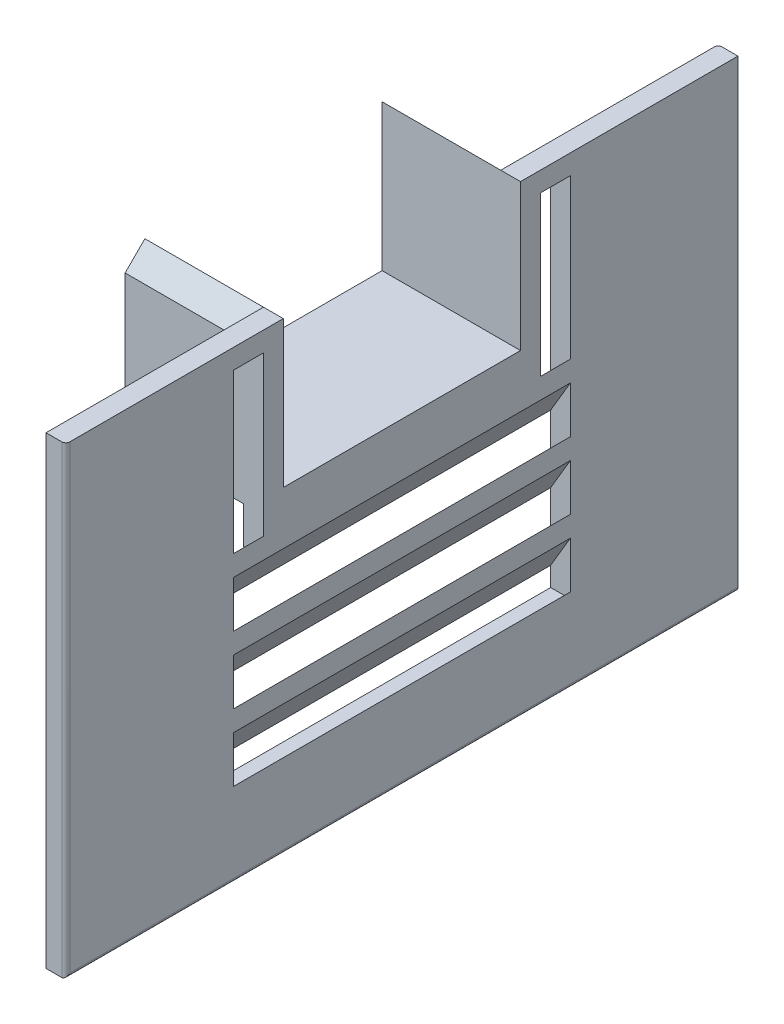
from build123d import *

# Parameters (mm, degrees)
BOSS_EXTRU_3_DEPTH             = 5
ESQUISSE6_W                    = 85.242430228
ESQUISSE6_H                    = 5.217313119
R_P_TITION_LIN_AIRE1_COUNT     = 3
R_P_TITION_LIN_AIRE1_PITCH     = 17
R_P_TITION_LIN_AIRE1_COL_COUNT = 2
R_P_TITION_LIN_AIRE1_COL_PITCH = 17
CONG_1_R                       = 1
BOSS_EXTRU_5_DEPTH             = 30


with BuildPart() as part:
    # Esquisse2 → Boss.-Extru.3 (new body)
    with BuildSketch(Plane(origin=(0, 0, 0), x_dir=(0, 0, -1), z_dir=(1, 0, 0))):
        Polygon((85, 62.151677918), (30, 62.151677918), (30, 25.151677918), (0, 25.151677918), (0, 12.151677918), (35, 12.151677918), (35, 57.151677918), (42.621215114, 57.151677918), (42.621215114, -35.567359792), (0, -35.567359792), (0, -55.200485129), (85, -55.200485129), align=None)
    boss_extru_3 = extrude(amount=BOSS_EXTRU_3_DEPTH)

    # Symétrie1: Boss.-Extru.3 across plane
    add(boss_extru_3.mirror(Plane.XY))

    # Balayage5: sweep along a path in Esquisse5
    with BuildLine(Plane.XY.offset(-42.621215114)) as balayage5_path:
        Line((0, -30.703084538), (5, -22.249219394))
    # Esquisse6 → Balayage5 (sweep)
    with BuildSketch(Plane(origin=(0, 0, 0), x_dir=(0, 0, -1), z_dir=(1, 0, 0))):
        with Locations((0, -28.094427979)):
            Rectangle(ESQUISSE6_W, ESQUISSE6_H)
    balayage5 = sweep(path=balayage5_path.line)

    # Répétition linéaire1: Balayage5 ×3
    with Locations(*[(0, i * R_P_TITION_LIN_AIRE1_PITCH, 0) for i in range(1, R_P_TITION_LIN_AIRE1_COUNT)]):
        add(balayage5)

    # Répétition linéaire1 col: Balayage5 ×2
    with Locations(*[(0, -i * R_P_TITION_LIN_AIRE1_COL_PITCH, 0) for i in range(1, R_P_TITION_LIN_AIRE1_COL_COUNT)]):
        add(balayage5)

    # Congé1
    cong_1_edges = [part.edges().sort_by_distance(p)[0] for p in [
        (0, 3.475596394, -85),
        (5, -55.200485129, 0),
        (5, 3.475596394, 85),
    ]]
    fillet(cong_1_edges, radius=CONG_1_R)

    # Esquisse8 → Boss.-Extru.5 (add)
    with BuildSketch(Plane.ZY):
        Polygon((-30, 62.151677918), (-30, 25.151677918), (30, 25.151677918), (30, 62.151677918), (35, 57.151677918), (35, 21.565276585), (-35, 21.565276585), (-35, 57.151677918), align=None)
    extrude(amount=BOSS_EXTRU_5_DEPTH)


solid = part.part
